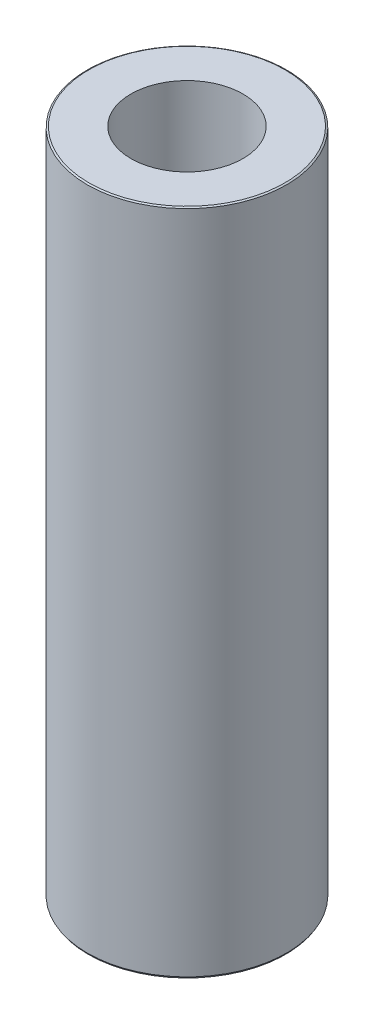
from build123d import *
from OCP.BRepFilletAPI import BRepFilletAPI_MakeChamfer

# Parameters (mm, degrees)
SKETCH1_R           = 55
BOSS_EXTRUDE1_DEPTH = 368.78973204
SKETCH2_R           = 30.946504916
CUT_EXTRUDE1_DEPTH  = 377.902993432
CHAMFER1_SIZE       = 0.499395332
CHAMFER1_SIZE2      = 0.880697048


with BuildPart() as part:
    # Sketch1 → Boss-Extrude1 (new body)
    with BuildSketch(Plane(origin=(0, 0, 0), x_dir=(1, 0, 0), z_dir=(0, 1, 0))):
        Circle(SKETCH1_R)
    extrude(amount=BOSS_EXTRUDE1_DEPTH)

    # Sketch2 → Cut-Extrude1 (cut, through all)
    with BuildSketch(Plane(origin=(0, 0, 0), x_dir=(1, 0, 0), z_dir=(0, 1, 0))):
        Circle(SKETCH2_R)
    extrude(amount=CUT_EXTRUDE1_DEPTH, mode=Mode.SUBTRACT)

    # Chamfer1: one chamfer whose edges measure the first distance from different faces: ONE call of the kernel's chamfer builder (chamfer() names one face for all edges)
    chamfer1_edges_1 = [part.edges().sort_by_distance(p)[0] for p in [
        (-55, 368.78973204, 0),
    ]]
    chamfer1_side_1 = [part.faces().sort_by_distance(p)[0] for p in [
        (-55, 184.39486602, 0),
    ]]
    chamfer1_edges_2 = [part.edges().sort_by_distance(p)[0] for p in [
        (-55, 0, 0),
    ]]
    chamfer1_side_2 = [part.faces().sort_by_distance(p)[0] for p in [
        (-53.444365081, 0, 0),
    ]]
    chamfer1 = BRepFilletAPI_MakeChamfer(part.part.solid().wrapped)
    for e in chamfer1_edges_1:
        chamfer1.Add(CHAMFER1_SIZE, CHAMFER1_SIZE2, e.wrapped, chamfer1_side_1[0].wrapped)  # the first distance lies on this face
    for e in chamfer1_edges_2:
        chamfer1.Add(CHAMFER1_SIZE, CHAMFER1_SIZE2, e.wrapped, chamfer1_side_2[0].wrapped)  # the first distance lies on this face
    add(Compound.cast(chamfer1.Shape()), mode=Mode.REPLACE)


solid = part.part
